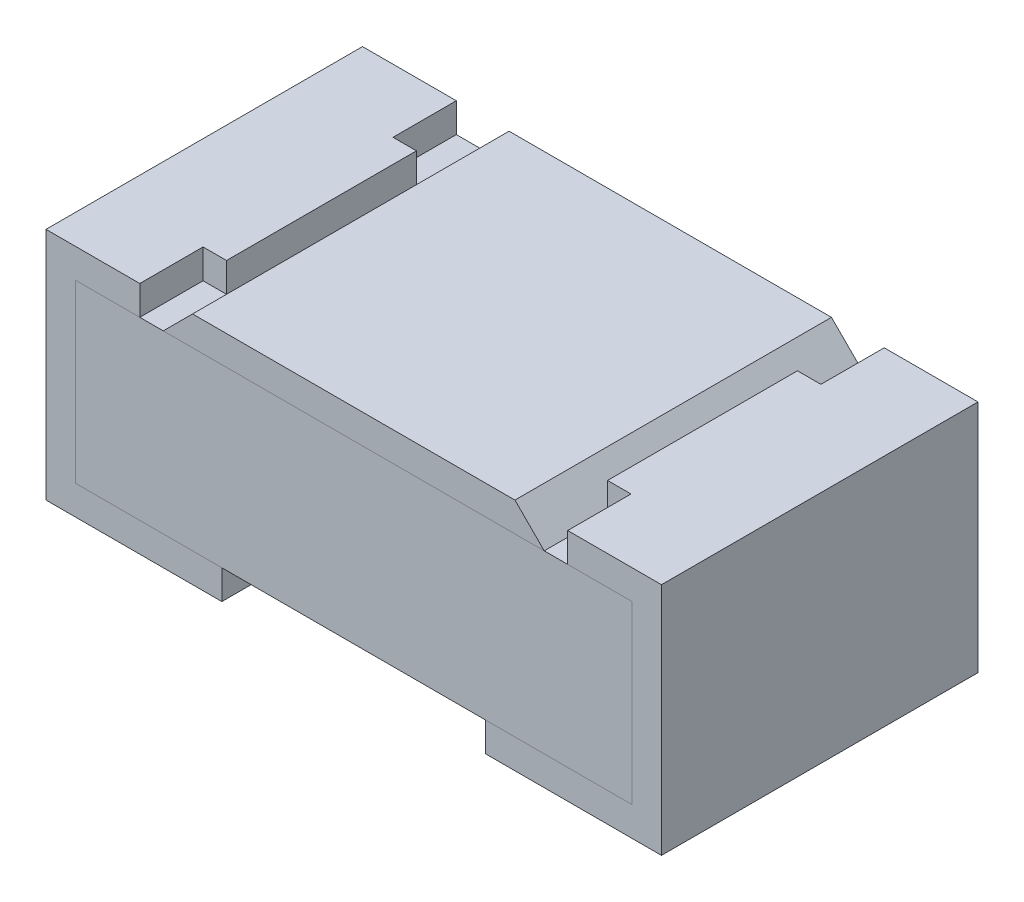
from build123d import *

# Parameters (mm, degrees)
EXTRUDE_START       = 0.05
SKETCH_1_W          = 0.95
SKETCH_1_H          = 0.54
EXTRUDE_1_DEPTH     = 0.3
SKETCH_3_W          = 0.65
SKETCH_3_H          = 0.54
EXTRUDE_2_DEPTH     = 0.05
CHAMFER_1_SIZE      = 0.05
EXTRUDE_3_DEPTH     = 0.54
EXTRUDE_3_2_DEPTH   = 0.54
SKETCH_5_W          = 0.04
SKETCH_5_H          = 0.108
CUT_EXTRUDE_1_DEPTH = 0.05


with BuildPart() as part:
    # Эскиз1 → Бобышка-Вытянуть1 (new body)
    with BuildSketch(Plane(origin=(0, 0, 0), x_dir=(1, 0, 0), z_dir=(0, 1, 0)).offset(EXTRUDE_START)):
        Rectangle(SKETCH_1_W, SKETCH_1_H)
    extrude(amount=EXTRUDE_1_DEPTH)


with BuildPart() as body_2:
    # Эскиз3 → Бобышка-Вытянуть2 (new body)
    with BuildSketch(Plane(origin=(0, 0.35, 0), x_dir=(1, 0, 0), z_dir=(0, 1, 0))):
        Rectangle(SKETCH_3_W, SKETCH_3_H)
    extrude(amount=EXTRUDE_2_DEPTH)

    # Фаска1
    # the kernel refuses this chamfer: 0.05 mm, written as the material it takes off along each edge
    with BuildSketch(Plane(origin=(-0.325, 0.4, 0.398584149), x_dir=(-0.027495876610586285, -0.9996219169112968, 0), z_dir=(0, 0, -1)), Plane(origin=(0.325, 0.4, -0.398584149), x_dir=(0.027495876610586285, -0.9996219169112968, 0), z_dir=(0, 0, 1))) as chamfer_1_piece_1:
        Polygon((CHAMFER_1_SIZE * 0.999621916911, -CHAMFER_1_SIZE * 0.0274958766106), (-CHAMFER_1_SIZE * 0.0274958766106, -CHAMFER_1_SIZE * 0.999621916911), (0, 0), align=None)
    extrude(amount=0.797168299, mode=Mode.SUBTRACT)


with BuildPart() as body_3:
    # Эскиз4 → Бобышка-Вытянуть3 (new body)
    with BuildSketch(Plane.XY.offset(0.27)):
        Polygon((-0.525, 0), (-0.525, 0.4), (-0.325, 0.4), (-0.325, 0.35), (-0.475, 0.35), (-0.475, 0.05), (-0.225, 0.05), (-0.225, 0), align=None)
    extrude(amount=-EXTRUDE_3_DEPTH)


with BuildPart() as body_4:
    # Эскиз4 → Extrude 3 2 (new body)
    with BuildSketch(Plane.XY.offset(0.27)):
        Polygon((0.225, 0.05), (0.475, 0.05), (0.475, 0.35), (0.325, 0.35), (0.325, 0.4), (0.525, 0.4), (0.525, 0), (0.225, 0), align=None)
    extrude(amount=-EXTRUDE_3_2_DEPTH)


with BuildPart() as cut_extrude_1_tool:
    # Эскиз5 → Вырез-Вытянуть1 (new body)
    with BuildSketch(Plane(origin=(0, 0.4, 0), x_dir=(1, 0, 0), z_dir=(0, 1, 0))):
        with Locations((0.345, 0.216)):
            Rectangle(SKETCH_5_W, SKETCH_5_H)
        with Locations((-0.345, 0.216)):
            Rectangle(SKETCH_5_W, SKETCH_5_H)
        with Locations((-0.345, -0.216)):
            Rectangle(SKETCH_5_W, SKETCH_5_H)
        with Locations((0.345, -0.216)):
            Rectangle(SKETCH_5_W, SKETCH_5_H)
    extrude(amount=-CUT_EXTRUDE_1_DEPTH)


with BuildPart() as body_3_1:
    add(body_3.part)

    # Вырез-Вытянуть1: cut by cut_extrude_1_tool
    add(cut_extrude_1_tool.part, mode=Mode.SUBTRACT)


with BuildPart() as body_4_1:
    add(body_4.part)

    # Вырез-Вытянуть1: cut by cut_extrude_1_tool
    add(cut_extrude_1_tool.part, mode=Mode.SUBTRACT)


solid = Compound([part.part, body_2.part, body_3_1.part, body_4_1.part])
